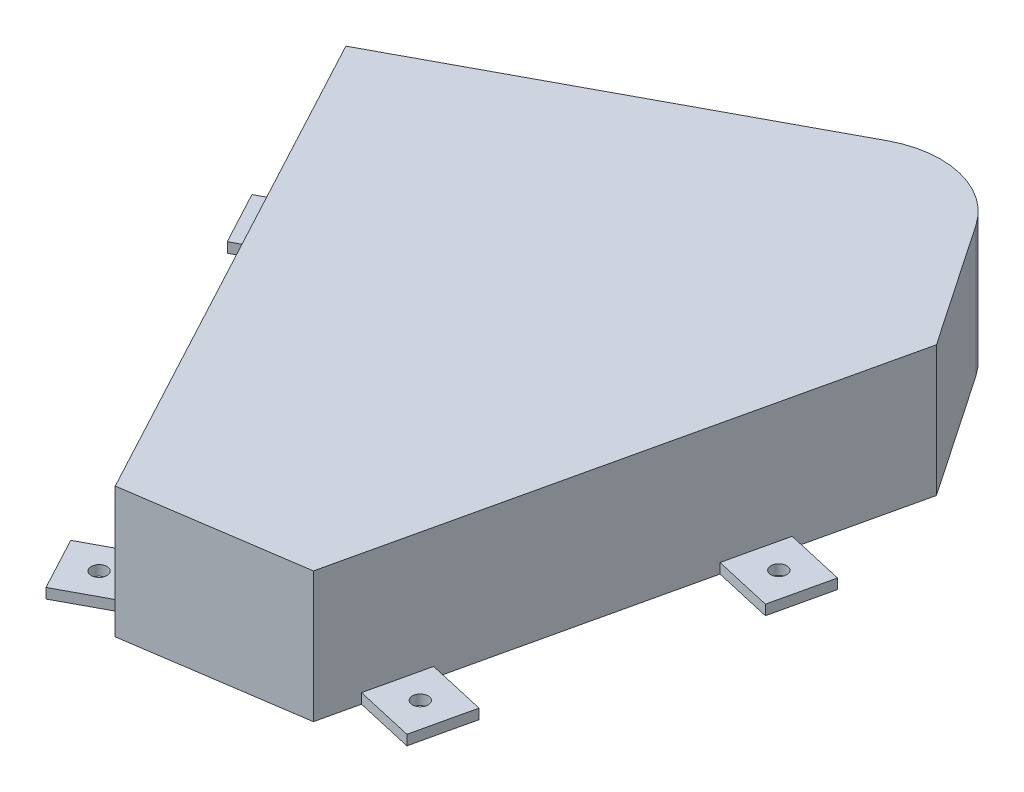
from build123d import *

# Parameters (mm, degrees)
BOSS_EXTRUDE1_DEPTH = 2.54
BOSS_EXTRUDE5_START = -41.275
BOSS_EXTRUDE5_DEPTH = 41.275
SKETCH6_W           = 19.05
SKETCH6_H           = 3.175
BOSS_EXTRUDE6_DEPTH = 19.05
SKETCH7_W           = 19.05
SKETCH7_H           = 3.175
BOSS_EXTRUDE7_DEPTH = 19.05
CUT_EXTRUDE2_REACH  = 244.018
SKETCH8_R           = 2.4892


with BuildPart() as part:
    # Sketch1 → Boss-Extrude1 (new body)
    with BuildSketch(Plane(origin=(0, 0, 0), x_dir=(1, 0, 0), z_dir=(0, 1, 0))):
        with BuildLine():
            Line((108.694500094, 58.18760289), (0, 0))
            Line((0, 0), (81.435616874, -152.121813345))
            Line((81.435616874, -152.121813345), (131.633654365, -144.676094857))
            Line((131.633654365, -144.676094857), (167.396796738, 12.253350144))
            Line((167.396796738, 12.253350144), (141.688668345, 50.073487268))
            ThreePointArc((141.688668345, 50.073487268), (126.748044303, 60.459528823), (108.694500094, 58.18760289))
        make_face()
    extrude(amount=BOSS_EXTRUDE1_DEPTH)

    # Sketch2 → Boss-Extrude5 (add)
    with BuildSketch(Plane(origin=(0, 2.54, 0), x_dir=(1, 0, 0), z_dir=(0, 1, 0)).offset(BOSS_EXTRUDE5_START)):
        with BuildLine():
            Line((79.691089457, -155.590310016), (-4.297615284, 1.300674006))
            Line((-4.297615284, 1.300674006), (107.196029455, 60.986747535))
            ThreePointArc((107.196029455, 60.986747535), (127.50626669, 63.54266421), (144.314468737, 51.85836746))
            Line((144.314468737, 51.85836746), (170.799497483, 12.895304744))
            Line((170.799497483, 12.895304744), (134.24691646, -147.498214188))
            Line((134.24691646, -147.498214188), (79.691089457, -155.590310016))
        make_face()
        with BuildLine():
            Line((81.435616874, -152.121813345), (0, 0))
            Line((0, 0), (108.694500094, 58.18760289))
            ThreePointArc((108.694500094, 58.18760289), (126.748044303, 60.459528823), (141.688668345, 50.073487268))
            Line((141.688668345, 50.073487268), (167.396796738, 12.253350144))
            Line((167.396796738, 12.253350144), (131.633654365, -144.676094857))
            Line((131.633654365, -144.676094857), (81.435616874, -152.121813345))
        make_face(mode=Mode.SUBTRACT)
    extrude(amount=BOSS_EXTRUDE5_DEPTH)

    # Sketch6 → Boss-Extrude6 (add)
    with BuildSketch(Plane(origin=(159.573264194, 0, 36.365650604), x_dir=(0.22219624877847344, 0, -0.9750019625768838), z_dir=(0.9750019625768838, 0, 0.22219624877847344))):
        with Locations((2.898955068, -37.1475)):
            Rectangle(SKETCH6_W, SKETCH6_H)
        with Locations((-91.756887063, -37.1475)):
            Rectangle(SKETCH6_W, SKETCH6_H)
    extrude(amount=BOSS_EXTRUDE6_DEPTH)

    # Sketch7 → Boss-Extrude7 (add)
    with BuildSketch(Plane(origin=(-2.799144645, 0, 1.498470639), x_dir=(0.4719592564431422, 0, 0.8816203606188076), z_dir=(-0.8816203606188077, 0, 0.47195925644314224))):
        with Locations((15.875, -37.1475)):
            Rectangle(SKETCH7_W, SKETCH7_H)
        with Locations((155.73253255, -37.1475)):
            Rectangle(SKETCH7_W, SKETCH7_H)
    extrude(amount=BOSS_EXTRUDE7_DEPTH)

    # Sketch8 → Cut-Extrude2 (cut, up to next)
    with BuildSketch(Plane(origin=(0, -35.56, 0), x_dir=(1, 0, 0), z_dir=(0, 1, 0)), mode=Mode.PRIVATE) as cut_extrude2_sk1:
        with Locations((-3.704225384, -19.989605782)):
            Circle(SKETCH8_R)
    cut_extrude2_tool1 = extrude(cut_extrude2_sk1.sketch, amount=-CUT_EXTRUDE2_REACH, mode=Mode.PRIVATE) & part.part
    # Sketch8 → Cut-Extrude2 (cut, up to next)
    with BuildSketch(Plane(origin=(0, -35.56, 0), x_dir=(1, 0, 0), z_dir=(0, 1, 0)), mode=Mode.PRIVATE) as cut_extrude2_sk2:
        with Locations((62.302831686, -143.290854064)):
            Circle(SKETCH8_R)
    cut_extrude2_tool2 = extrude(cut_extrude2_sk2.sketch, amount=-CUT_EXTRUDE2_REACH, mode=Mode.PRIVATE) & part.part
    # Sketch8 → Cut-Extrude2 (cut, up to next)
    with BuildSketch(Plane(origin=(0, -35.56, 0), x_dir=(1, 0, 0), z_dir=(0, 1, 0)), mode=Mode.PRIVATE) as cut_extrude2_sk3:
        with Locations((148.472121782, -127.945214839)):
            Circle(SKETCH8_R)
    cut_extrude2_tool3 = extrude(cut_extrude2_sk3.sketch, amount=-CUT_EXTRUDE2_REACH, mode=Mode.PRIVATE) & part.part
    # Sketch8 → Cut-Extrude2 (cut, up to next)
    with BuildSketch(Plane(origin=(0, -35.56, 0), x_dir=(1, 0, 0), z_dir=(0, 1, 0)), mode=Mode.PRIVATE) as cut_extrude2_sk4:
        with Locations((169.504294829, -35.655582993)):
            Circle(SKETCH8_R)
    cut_extrude2_tool4 = extrude(cut_extrude2_sk4.sketch, amount=-CUT_EXTRUDE2_REACH, mode=Mode.PRIVATE) & part.part
    add(cut_extrude2_tool1.solids().sort_by_distance((-3.704225, -35.56, 19.989606))[0], mode=Mode.SUBTRACT)
    add(cut_extrude2_tool2.solids().sort_by_distance((62.302832, -35.56, 143.290854))[0], mode=Mode.SUBTRACT)
    add(cut_extrude2_tool3.solids().sort_by_distance((148.472122, -35.56, 127.945215))[0], mode=Mode.SUBTRACT)
    add(cut_extrude2_tool4.solids().sort_by_distance((169.504295, -35.56, 35.655583))[0], mode=Mode.SUBTRACT)


solid = part.part
